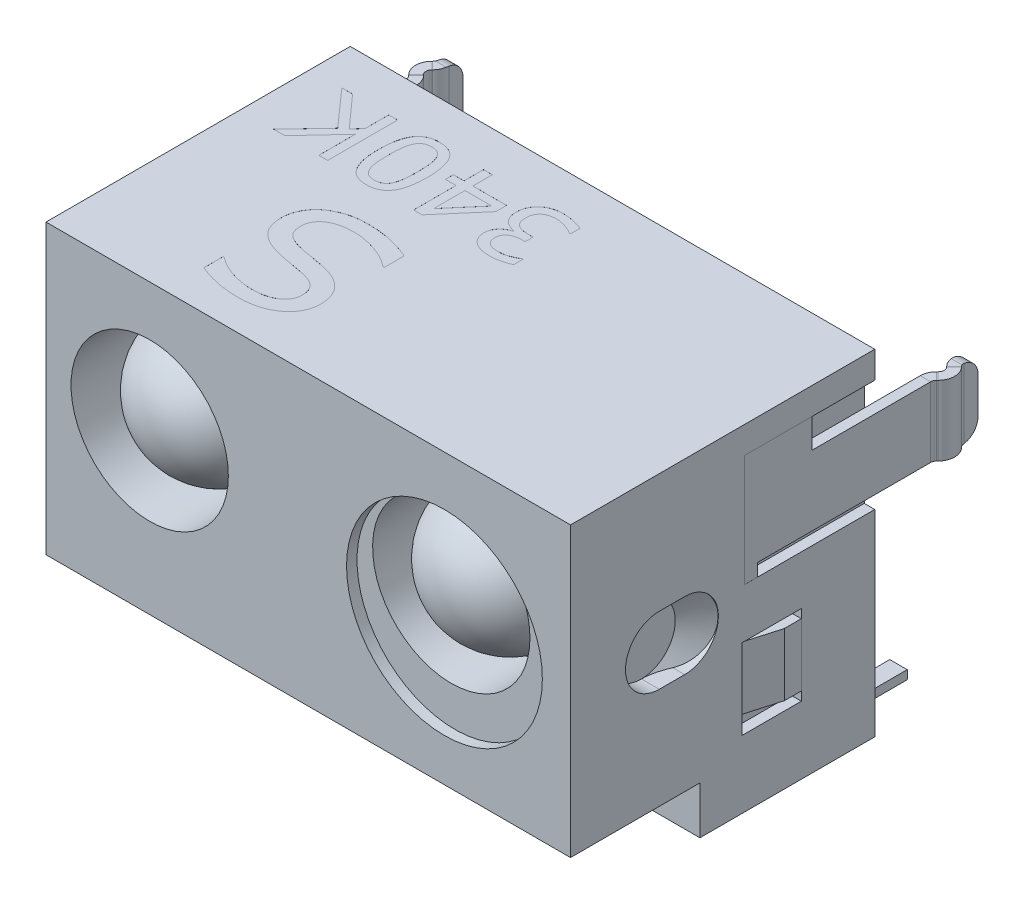
from build123d import *

# Parameters (mm, degrees)
SKETCH_1_W              = 15
SKETCH_1_H              = 9.6
EXTRUDE_1_DEPTH         = 4.3
SKETCH_2_W              = 15
SKETCH_2_H              = 8.24
EXTRUDE_2_DEPTH         = 3.7
SKETCH_3_R              = 2.25
CUT_EXTRUDE_1_DEPTH     = 2
SKETCH_4_R              = 2.8
CUT_EXTRUDE_2_DEPTH     = 0.3
SKETCH_5_R              = 2
EXTRUDE_3_DEPTH         = 0.01
SKETCH_6_W              = 1.692
SKETCH_6_H              = 2.296
CUT_EXTRUDE_3_DEPTH     = 0.3
SKETCH_7_W              = 3.021
SKETCH_7_H              = 3.2
CUT_EXTRUDE_4_DEPTH     = 0.3
SKETCH_10_W             = 3.021
SKETCH_10_H             = 3.2
CUT_EXTRUDE_5_DEPTH     = 0.3
SKETCH_11_W             = 3.021
SKETCH_11_H             = 0.3
CUT_EXTRUDE_6_DEPTH     = 20.297929941
SKETCH_14_W             = 12.76
SKETCH_14_H             = 1.791
CUT_EXTRUDE_8_DEPTH     = 0.01
SKETCH_15_W             = 0.5
SKETCH_15_H             = 0.25
EXTRUDE_4_DEPTH         = 1.31
SM_BASE_FLANGE_3_DEPTH  = 0.299
SM_EDGE_FLANGE_5_DEPTH  = 2
SM_EDGE_FLANGE_7_DEPTH  = 2
SM_EDGE_FLANGE_8_DEPTH  = 2
FILLET_1_R              = 0.473
FILLET_2_R              = 0.473
SM_BASE_FLANGE_4_DEPTH  = 0.299
SM_EDGE_FLANGE_9_DEPTH  = 2
SM_EDGE_FLANGE_10_DEPTH = 2
SM_EDGE_FLANGE_11_DEPTH = 2
FILLET_3_R              = 0.473
SKETCH_73_W             = 0.5
SKETCH_73_H             = 0.25
EXTRUDE_8_DEPTH         = 4.65
FILLET_4_R              = 0.5
FILLET_5_R              = 0.25
SKETCH_74_W             = 1.531
SKETCH_74_H             = 1.79
EXTRUDE_9_DEPTH         = 0.299
CHAMFER_1_SIZE2         = 0.299
CHAMFER_1_SIZE          = 1.047
EXTRUDE_11_DEPTH        = 0.7
SKETCH_77_W             = 1.692
SKETCH_77_H             = 2.296
CUT_EXTRUDE_11_DEPTH    = 0.3
SKETCH_78_W             = 1.531
SKETCH_78_H             = 1.79
EXTRUDE_12_DEPTH        = 0.299
CHAMFER_2_SIZE2         = 0.299
CHAMFER_2_SIZE          = 1.047
CUT_EXTRUDE_12_DEPTH    = 0.01
SKETCH_80_R             = 0.966
CUT_EXTRUDE_14_DEPTH    = 0.5
CHAMFER_START           = 14.49
CHAMFER_3_DEPTH         = 0.5
CUT_EXTRUDE_15_DEPTH    = 0.001
CUT_EXTRUDE_16_DEPTH    = 0.001


with BuildPart() as part:
    # Эскиз1 → Бобышка-Вытянуть1 (new body)
    with BuildSketch(Plane.XY):
        with Locations((7.5, -4.8)):
            Rectangle(SKETCH_1_W, SKETCH_1_H)
    extrude(amount=EXTRUDE_1_DEPTH)

    # Эскиз2 → Бобышка-Вытянуть2 (add)
    with BuildSketch(Plane.XY.offset(4.3)):
        with Locations((7.5, -4.12)):
            Rectangle(SKETCH_2_W, SKETCH_2_H)
    extrude(amount=EXTRUDE_2_DEPTH)

    # Sketch 3 → Вырез-Вытянуть1 (cut)
    with BuildSketch(Plane.XY.offset(8)):
        with Locations((2.965, -3.68)):
            Circle(SKETCH_3_R)
        with Locations((11.29, -3.68)):
            Circle(SKETCH_3_R)
    extrude(amount=-CUT_EXTRUDE_1_DEPTH, mode=Mode.SUBTRACT)

    # Sketch 4 → Вырез-Вытянуть2 (cut)
    with BuildSketch(Plane.XY.offset(8)):
        with Locations((11.394403065, -4.22)):
            Circle(SKETCH_4_R)
    extrude(amount=-CUT_EXTRUDE_2_DEPTH, mode=Mode.SUBTRACT)

    # Эскиз5 → Бобышка-Вытянуть3 (add)
    with BuildSketch(Plane.XY.offset(6)):
        with Locations(Location((2.965, -3.68, 0), (0, 0, 180))):
            Circle(SKETCH_5_R)
        with Locations(Location((11.29, -3.68, 0), (0, 0, 180))):
            Circle(SKETCH_5_R)
    extrude(amount=EXTRUDE_3_DEPTH)

    # Купол2: read off the stored shape, not the designer's step
    # Купол2 outline → Купол2 (revolve)
    with BuildSketch(Plane(origin=(2.965, -3.68, 0), x_dir=(1, 0, 0), z_dir=(0, -1, 0))):
        with BuildLine():
            Line((0, 6.01), (2, 6.009999998))
            ThreePointArc((2, 6.009999998), (1.414213563, 7.424213562), (0, 8.01))
            Line((0, 8.01), (0, 6.01))
        make_face()
    revolve(axis=Axis((2.965, -3.68, 0), (0, 0, 1)))

    # Купол3: read off the stored shape, not the designer's step
    # Купол3 outline → Купол3 (revolve)
    with BuildSketch(Plane(origin=(11.29, -3.68, 0), x_dir=(1, 0, 0), z_dir=(0, -1, 0))):
        with BuildLine():
            Line((0, 6.01), (2, 6.009999998))
            ThreePointArc((2, 6.009999998), (1.414213563, 7.424213562), (0, 8.01))
            Line((0, 8.01), (0, 6.01))
        make_face()
    revolve(axis=Axis((11.29, -3.68, 0), (0, 0, 1)))

    # Эскиз6 → Вырез-Вытянуть3 (cut)
    with BuildSketch(Plane(origin=(15, 0, 0), x_dir=(0, 0, -1), z_dir=(1, 0, 0))):
        with Locations((-2.246, -6.519)):
            Rectangle(SKETCH_6_W, SKETCH_6_H)
    extrude(amount=-CUT_EXTRUDE_3_DEPTH, mode=Mode.SUBTRACT)

    # Эскиз7 → Вырез-Вытянуть4 (cut)
    with BuildSketch(Plane(origin=(15, 0, 0), x_dir=(0, 0, -1), z_dir=(1, 0, 0))):
        with Locations((-1.5105, -2.368)):
            Rectangle(SKETCH_7_W, SKETCH_7_H)
    extrude(amount=-CUT_EXTRUDE_4_DEPTH, mode=Mode.SUBTRACT)

    # Эскиз10 → Вырез-Вытянуть5 (cut)
    with BuildSketch(Plane.ZY):
        with Locations((1.5105, -2.368)):
            Rectangle(SKETCH_10_W, SKETCH_10_H)
    extrude(amount=-CUT_EXTRUDE_5_DEPTH, mode=Mode.SUBTRACT)

    # Эскиз11 → Вырез-Вытянуть6 (cut, through all)
    with BuildSketch(Plane(origin=(14.7, 0, 0), x_dir=(0, 0, -1), z_dir=(1, 0, 0))):
        with Locations((-1.5105, -0.918)):
            Rectangle(SKETCH_11_W, SKETCH_11_H)
    extrude(amount=-CUT_EXTRUDE_6_DEPTH, mode=Mode.SUBTRACT)

    # Эскиз14 → Вырез-Вытянуть8 (cut)
    with BuildSketch(Plane.XZ.offset(9.6)):
        with Locations((7.5, 0.8955)):
            Rectangle(SKETCH_14_W, SKETCH_14_H)
    extrude(amount=-CUT_EXTRUDE_8_DEPTH, mode=Mode.SUBTRACT)

    # Эскиз15 → Бобышка-Вытянуть4 (add)
    with BuildSketch(Plane.XZ.offset(9.59)):
        with Locations((5, 0.8955)):
            Rectangle(SKETCH_15_W, SKETCH_15_H)
        with Locations((2.5, 0.8955)):
            Rectangle(SKETCH_15_W, SKETCH_15_H)
        with Locations((7.5, 0.8955)):
            Rectangle(SKETCH_15_W, SKETCH_15_H)
        with Locations((10, 0.8955)):
            Rectangle(SKETCH_15_W, SKETCH_15_H)
        with Locations((12.5, 0.8955)):
            Rectangle(SKETCH_15_W, SKETCH_15_H)
    extrude(amount=EXTRUDE_4_DEPTH)

    # Эскиз73 → Бобышка-Вытянуть8 (add)
    with BuildSketch(Plane(origin=(0, 0, 0.7705), x_dir=(-1, 0, 0), z_dir=(0, 0, -1))):
        with Locations((-2.5, -10.775)):
            Rectangle(SKETCH_73_W, SKETCH_73_H)
        with Locations((-5, -10.775)):
            Rectangle(SKETCH_73_W, SKETCH_73_H)
        with Locations((-7.5, -10.775)):
            Rectangle(SKETCH_73_W, SKETCH_73_H)
        with Locations((-10, -10.775)):
            Rectangle(SKETCH_73_W, SKETCH_73_H)
        with Locations((-12.5, -10.775)):
            Rectangle(SKETCH_73_W, SKETCH_73_H)
    extrude(amount=EXTRUDE_8_DEPTH)

    # Скругление4
    fillet_4_edges = [part.edges().sort_by_distance(p)[0] for p in [
        (2.5, -10.9, 1.0205),
        (5, -10.9, 1.0205),
        (7.5, -10.9, 1.0205),
        (10, -10.9, 1.0205),
        (12.5, -10.9, 1.0205),
    ]]
    fillet(fillet_4_edges, radius=FILLET_4_R)

    # Скругление5
    fillet_5_edges = [part.edges().sort_by_distance(p)[0] for p in [
        (2.5, -10.65, 0.7705),
        (5, -10.65, 0.7705),
        (7.5, -10.65, 0.7705),
        (10, -10.65, 0.7705),
        (12.5, -10.65, 0.7705),
    ]]
    fillet(fillet_5_edges, radius=FILLET_5_R)

    # Эскиз74 → Бобышка-Вытянуть9 (add)
    with BuildSketch(Plane(origin=(14.7, 0, 0), x_dir=(0, 0, -1), z_dir=(1, 0, 0))):
        with Locations((-2.1655, -6.519)):
            Rectangle(SKETCH_74_W, SKETCH_74_H)
    extrude(amount=EXTRUDE_9_DEPTH)

    # Фаска1
    chamfer_1_edges = [part.edges().sort_by_distance(p)[0] for p in [
        (14.999, -6.519, 2.931),
    ]]
    chamfer_1_side = [part.faces().sort_by_distance(p)[0] for p in [
        (14.999, -6.519, 2.92502),
    ]]
    chamfer(chamfer_1_edges, length=CHAMFER_1_SIZE - 0.0001, length2=CHAMFER_1_SIZE2 - 0.0001, reference=chamfer_1_side[0])  # a hair under: the kernel refuses the full size



with BuildPart() as body_2:
    # Базовая кромка3: sheet metal written as solids
    # Эскиз17 → Базовая кромка3 (new body)
    with BuildSketch(Plane(origin=(14.7, 0, 0), x_dir=(0, 0, -1), z_dir=(1, 0, 0))):
        Polygon((-1.088, -0.768), (-1.088, -1.6055), (2.3, -1.6055), (2.3, -3.6055), (-2.6585, -3.6055), (-2.6585, -3.968), (-3.021, -3.968), (-3.021, -0.768), align=None)
    extrude(amount=SM_BASE_FLANGE_3_DEPTH)

    # Ребро-кромка5: sheet metal written as solids
    # Ребро-кромка5 section (on a plane across the edge) → Ребро-кромка5 (add)
    with BuildSketch(Plane(origin=(14.999, -3.6055, -2.371658946), x_dir=(0.7071067811865512, 0, 0.7071067811865438), z_dir=(0, 1, 0))):
        with BuildLine():
            Line((-0.299, 0.071658946), (-0.299, 0.1))
            Line((-0.299, 0.1), (0, 0.1))
            Line((0, 0.1), (0, 0.071658946))
            ThreePointArc((0, 0.071658946), (0.013168841, 0.005454712), (0.050670527, -0.050670527))
            Line((0.050670527, -0.050670527), (-0.160754401, -0.262095454))
            ThreePointArc((-0.160754401, -0.262095454), (-0.263071139, -0.108967634), (-0.299, 0.071658946))
        make_face()
    extrude(amount=SM_EDGE_FLANGE_5_DEPTH)

    # Ребро-кромка7: sheet metal written as solids
    # Ребро-кромка7 section (on a plane across the edge) → Ребро-кромка7 (add)
    with BuildSketch(Plane(origin=(14.980615224, -1.6055, -2.776124025), x_dir=(-0.7071067811865478, 0, 0.7071067811865472), z_dir=(0, -1, 0))):
        with BuildLine():
            Line((-0.299, 0.173), (-0.299, 0.18))
            Line((-0.299, 0.18), (0, 0.18))
            Line((0, 0.18), (0, 0.173))
            ThreePointArc((0, 0.173), (0.050670527, 0.050670527), (0.173, 0))
            Line((0.173, 0), (0.173, -0.299))
            ThreePointArc((0.173, -0.299), (-0.160754401, -0.160754401), (-0.299, 0.173))
        make_face()
    extrude(amount=SM_EDGE_FLANGE_7_DEPTH)

    # Ребро-кромка8: sheet metal written as solids
    # Ребро-кромка8 section (on a plane across the edge) → Ребро-кромка8 (add)
    with BuildSketch(Plane(origin=(15.014090404, -3.6055, -3.1654987), x_dir=(1, 0, 0), z_dir=(0, 1, 0))):
        with BuildLine():
            Line((-0.299, 0.071658946), (-0.299, 0.473))
            Line((-0.299, 0.473), (0, 0.473))
            Line((0, 0.473), (0, 0.071658946))
            ThreePointArc((0, 0.071658946), (0.013168841, 0.005454712), (0.050670527, -0.050670527))
            Line((0.050670527, -0.050670527), (-0.160754401, -0.262095454))
            ThreePointArc((-0.160754401, -0.262095454), (-0.263071139, -0.108967634), (-0.299, 0.071658946))
        make_face()
    extrude(amount=SM_EDGE_FLANGE_8_DEPTH)

    # Скругление1
    fillet_1_edges = [body_2.edges().sort_by_distance(p)[0] for p in [
        (14.864590404, -3.6055, -3.6384987),
    ]]
    fillet(fillet_1_edges, radius=FILLET_1_R)

    # Скругление2
    fillet_2_edges = [body_2.edges().sort_by_distance(p)[0] for p in [
        (14.864590404, -1.6055, -3.6384987),
    ]]
    fillet(fillet_2_edges, radius=FILLET_2_R)


with BuildPart() as body_3:
    # Базовая кромка4: sheet metal written as solids
    # Эскиз61 → Базовая кромка4 (new body)
    with BuildSketch(Plane.ZY.offset(-0.3)):
        Polygon((2.661, -3.968), (2.661, -3.608), (-2.3, -3.608), (-2.3, -1.608), (1.091, -1.608), (1.091, -0.768), (3.021, -0.768), (3.021, -3.968), align=None)
    extrude(amount=SM_BASE_FLANGE_4_DEPTH)

    # Ребро-кромка9: sheet metal written as solids
    # Ребро-кромка9 section (on a plane across the edge) → Ребро-кромка9 (add)
    with BuildSketch(Plane(origin=(0.001, -1.608, -2.371658946), x_dir=(-0.7071067811865512, 0, 0.7071067811865438), z_dir=(0, -1, 0))):
        with BuildLine():
            Line((-0.299, 0.071658946), (-0.299, 0.1))
            Line((-0.299, 0.1), (0, 0.1))
            Line((0, 0.1), (0, 0.071658946))
            ThreePointArc((0, 0.071658946), (0.013168841, 0.005454712), (0.050670527, -0.050670527))
            Line((0.050670527, -0.050670527), (-0.160754401, -0.262095454))
            ThreePointArc((-0.160754401, -0.262095454), (-0.263071139, -0.108967634), (-0.299, 0.071658946))
        make_face()
    extrude(amount=SM_EDGE_FLANGE_9_DEPTH)

    # Ребро-кромка10: sheet metal written as solids
    # Ребро-кромка10 section (on a plane across the edge) → Ребро-кромка10 (add)
    with BuildSketch(Plane(origin=(0.019384776, -3.608, -2.776124025), x_dir=(0.7071067811865477, 0, 0.7071067811865475), z_dir=(0, 1, 0))):
        with BuildLine():
            Line((-0.299, 0.173), (-0.299, 0.18))
            Line((-0.299, 0.18), (0, 0.18))
            Line((0, 0.18), (0, 0.173))
            ThreePointArc((0, 0.173), (0.050670527, 0.050670527), (0.173, 0))
            Line((0.173, 0), (0.173, -0.299))
            ThreePointArc((0.173, -0.299), (-0.160754401, -0.160754401), (-0.299, 0.173))
        make_face()
    extrude(amount=SM_EDGE_FLANGE_10_DEPTH)

    # Ребро-кромка11: sheet metal written as solids
    # Ребро-кромка11 section (on a plane across the edge) → Ребро-кромка11 (add)
    with BuildSketch(Plane(origin=(-0.014090404, -1.608, -3.1654987), x_dir=(-1, 0, 0), z_dir=(0, -1, 0))):
        with BuildLine():
            Line((-0.299, 0.071658946), (-0.299, 0.473))
            Line((-0.299, 0.473), (0, 0.473))
            Line((0, 0.473), (0, 0.071658946))
            ThreePointArc((0, 0.071658946), (0.013168841, 0.005454712), (0.050670527, -0.050670527))
            Line((0.050670527, -0.050670527), (-0.160754401, -0.262095454))
            ThreePointArc((-0.160754401, -0.262095454), (-0.263071139, -0.108967634), (-0.299, 0.071658946))
        make_face()
    extrude(amount=SM_EDGE_FLANGE_11_DEPTH)

    # Скругление3
    fillet_3_edges = [body_3.edges().sort_by_distance(p)[0] for p in [
        (0.135409596, -3.608, -3.6384987),
        (0.135409596, -1.608, -3.6384987),
    ]]
    fillet(fillet_3_edges, radius=FILLET_3_R)


with BuildPart() as part_1:
    add(part.part)

    add(body_2.part)  # Бобышка-Вытянуть11 merges body 2

    add(body_3.part)  # Бобышка-Вытянуть11 merges body 3
    # Эскиз76 → Бобышка-Вытянуть11 (add)
    with BuildSketch(Plane(origin=(0, 0, 0), x_dir=(-1, 0, 0), z_dir=(0, 0, -1))):
        Polygon((-15, 0), (-15, -0.768), (-14.7, -0.768), (-14.7, -3.968), (-15, -3.968), (-15, -9.6), (0, -9.6), (0, -3.968), (-0.3, -3.968), (-0.3, -0.768), (0, -0.768), (0, 0), align=None)
    extrude(amount=EXTRUDE_11_DEPTH)

    # Эскиз77 → Вырез-Вытянуть11 (cut)
    with BuildSketch(Plane.ZY):
        with Locations((2.246, -6.519)):
            Rectangle(SKETCH_77_W, SKETCH_77_H)
    extrude(amount=-CUT_EXTRUDE_11_DEPTH, mode=Mode.SUBTRACT)

    # Эскиз78 → Бобышка-Вытянуть12 (add)
    with BuildSketch(Plane.ZY.offset(-0.3)):
        with Locations((2.1655, -6.519)):
            Rectangle(SKETCH_78_W, SKETCH_78_H)
    extrude(amount=EXTRUDE_12_DEPTH)

    # Фаска2
    chamfer_2_edges = [part_1.edges().sort_by_distance(p)[0] for p in [
        (0.001, -6.519, 2.931),
    ]]
    chamfer_2_side = [part_1.faces().sort_by_distance(p)[0] for p in [
        (0.001, -6.519, 2.92502),
    ]]
    chamfer(chamfer_2_edges, length=CHAMFER_2_SIZE - 0.0001, length2=CHAMFER_2_SIZE2 - 0.0001, reference=chamfer_2_side[0])  # a hair under: the kernel refuses the full size

    # Эскиз79 → Вырез-Вытянуть12 (cut)
    with BuildSketch(Plane(origin=(15, 0, 0), x_dir=(0, 0, -1), z_dir=(1, 0, 0))):
        with BuildLine():
            Line((-5.462, -3.408), (-4.737, -3.408))
            ThreePointArc((-4.737, -3.408), (-3.771, -4.374), (-4.737, -5.34))
            Line((-4.737, -5.34), (-5.462, -5.34))
            ThreePointArc((-5.462, -5.34), (-6.428, -4.374), (-5.462, -3.408))
        make_face()
    extrude(amount=-CUT_EXTRUDE_12_DEPTH, mode=Mode.SUBTRACT)

    # Эскиз80 → Вырез-Вытянуть14 (cut)
    with BuildSketch(Plane(origin=(14.99, 0, 0), x_dir=(0, 0, -1), z_dir=(1, 0, 0))):
        with Locations((-5.462, -4.374)):
            Circle(SKETCH_80_R)
    extrude(amount=-CUT_EXTRUDE_14_DEPTH, mode=Mode.SUBTRACT)

    # Фаска3: read off the stored shape, not the designer's step
    # Фаска3 outline → Фаска3 (cut)
    with BuildSketch(Plane.YZ.offset(CHAMFER_START)):
        with BuildLine():
            ThreePointArc((-5.34, 4.737), (-4.374, 3.771), (-3.408, 4.737))
            Line((-3.408, 4.737), (-3.408, 5.462))
            ThreePointArc((-3.408, 5.462), (-4.374, 4.496), (-5.34, 5.462))
            Line((-5.34, 5.462), (-5.34, 4.737))
        make_face()
    extrude(amount=CHAMFER_3_DEPTH, mode=Mode.SUBTRACT)

    # Chamfer 3 2 outline → Chamfer 3 2 (revolve)
    with BuildSketch(Plane(origin=(0, -4.374, 5.462), x_dir=(0, 1, 0), z_dir=(0, 0, -1))):
        Polygon((1.691, 14.99), (1.686, 14.99), (0.965997178, 14.489998041), (1.691, 14.49), align=None)
    revolve(axis=Axis((0, -4.374, 5.462), (1, 0, 0)))

    # Эскиз82 → Вырез-Вытянуть15 (cut)
    # profile 1 of 4: a face of its own
    with BuildSketch(Plane(origin=(0, 0, 0), x_dir=(-1, 0, 0), z_dir=(0, 1, 0))):
        with BuildLine():
            add(Edge.make_bspline(
                [(-6.623233444, 1.399667175), (-6.61272869, 1.389591118), (-6.591530093, 1.369257631), (-6.56346967, 1.334569579), (-6.538446512, 1.29619945), (-6.515999972, 1.254086049), (-6.497347226, 1.206635953), (-6.484640883, 1.153004201), (-6.477277251, 1.093041814), (-6.476233825, 1.051060607), (-6.475685976, 1.02901844)],
                knots=[0, 0, 0, 0, 0.847484043, 1.710223126, 2.592412854, 3.513457184, 4.486482436, 5.554204071, 6.715838676, 8, 8, 8, 8], degree=3))
            add(Edge.make_bspline(
                [(-6.475685976, 1.02901844), (-6.47631084, 1.006574098), (-6.477536469, 0.962551014), (-6.486710453, 0.897780745), (-6.502622493, 0.83605984), (-6.524347746, 0.777310245), (-6.551895511, 0.722236911), (-6.583982999, 0.670322807), (-6.621651008, 0.622249685), (-6.650363005, 0.593356411), (-6.664768254, 0.578860213)],
                knots=[0, 0, 0, 0, 1.072189339, 2.103028086, 3.117625413, 4.112331199, 5.08999265, 6.054966346, 7.024146796, 8, 8, 8, 8], degree=3))
            add(Edge.make_bspline(
                [(-6.664768254, 0.578860213), (-6.681991065, 0.563827282), (-6.716420034, 0.533775956), (-6.773950961, 0.495677187), (-6.835947528, 0.464167698), (-6.901855338, 0.438172762), (-6.971891474, 0.419232389), (-7.04507887, 0.404807326), (-7.121721954, 0.396478171), (-7.173846717, 0.395445696), (-7.20036952, 0.394920339)],
                knots=[0, 0, 0, 0, 0.94513944, 1.889365109, 2.845868606, 3.818496383, 4.815247057, 5.843513068, 6.902708155, 8, 8, 8, 8], degree=3))
            add(Edge.make_bspline(
                [(-7.20036952, 0.394920339), (-7.228078239, 0.395330407), (-7.283203462, 0.396146217), (-7.365599062, 0.4041613), (-7.447251984, 0.41618288), (-7.527042189, 0.433215729), (-7.602690688, 0.453175392), (-7.672323911, 0.474534742), (-7.735051671, 0.496321171), (-7.773762237, 0.512859314), (-7.792141672, 0.520711478)],
                knots=[0, 0, 0, 0, 1.091633847, 2.17175542, 3.259350248, 4.342654255, 5.384955613, 6.341552815, 7.212583926, 8, 8, 8, 8], degree=3))
            Line((-7.792141672, 0.520711478), (-7.792141672, 0.79998363))
            Line((-7.792141672, 0.79998363), (-7.771967621, 0.79998363))
            add(Edge.make_bspline(
                [(-7.771967621, 0.79998363), (-7.752348007, 0.787584369), (-7.712330593, 0.762294047), (-7.648003914, 0.728691518), (-7.578490775, 0.698728388), (-7.505187487, 0.672308148), (-7.43006877, 0.649870426), (-7.354947686, 0.634865168), (-7.281216384, 0.624588269), (-7.232444311, 0.623371347), (-7.208280913, 0.62276844)],
                knots=[0, 0, 0, 0, 0.930231768, 1.897359876, 2.905960645, 3.962824014, 5.020110383, 6.045473768, 7.03165901, 8, 8, 8, 8], degree=3))
            add(Edge.make_bspline(
                [(-7.208280913, 0.62276844), (-7.194021607, 0.62302237), (-7.164870005, 0.623541501), (-7.120759286, 0.629564721), (-7.075288225, 0.638244852), (-7.02947272, 0.650242567), (-6.984864777, 0.665499337), (-6.944009377, 0.685073491), (-6.907101839, 0.707267099), (-6.885933245, 0.725449435), (-6.875606862, 0.734319073)],
                knots=[0, 0, 0, 0, 0.955105117, 1.9526087, 2.978673282, 4.056885304, 5.124578998, 6.132597257, 7.089050672, 8, 8, 8, 8], degree=3))
            add(Edge.make_bspline(
                [(-6.875606862, 0.734319073), (-6.865732151, 0.744252572), (-6.846364193, 0.763735834), (-6.822000928, 0.79625924), (-6.800696655, 0.829518098), (-6.783258711, 0.864966337), (-6.770039931, 0.903904843), (-6.760735332, 0.947024201), (-6.755278695, 0.994860448), (-6.754548415, 1.028212513), (-6.754166988, 1.045632364)],
                knots=[0, 0, 0, 0, 0.974089691, 1.910549984, 2.822386268, 3.721564009, 4.653513387, 5.678162238, 6.787299389, 8, 8, 8, 8], degree=3))
            add(Edge.make_bspline(
                [(-6.754166988, 1.045632364), (-6.754437958, 1.062801415), (-6.754959301, 1.09583458), (-6.761905316, 1.142861414), (-6.772297517, 1.185479589), (-6.787601508, 1.223345481), (-6.806159084, 1.257360801), (-6.828521452, 1.287190629), (-6.853995594, 1.313409328), (-6.873413849, 1.327665757), (-6.883122685, 1.334793757)],
                knots=[0, 0, 0, 0, 1.246176778, 2.397637793, 3.445421562, 4.425515979, 5.35590216, 6.252488577, 7.126270542, 8, 8, 8, 8], degree=3))
            add(Edge.make_bspline(
                [(-6.883122685, 1.334793757), (-6.893650969, 1.341528336), (-6.914929578, 1.355139524), (-6.95042654, 1.370874151), (-6.988870019, 1.383518848), (-7.045283997, 1.396015278), (-7.121219901, 1.405277166), (-7.183332622, 1.406794944), (-7.215401166, 1.407578567)],
                knots=[0, 0, 0, 0, 0.651204319, 1.316142418, 2.018760635, 2.759665618, 4.327028642, 6, 6, 6, 6], degree=3))
            Line((-7.215401166, 1.407578567), (-7.336445469, 1.407578567))
            Line((-7.336445469, 1.407578567), (-7.336445469, 1.635426668))
            Line((-7.336445469, 1.635426668), (-7.244277748, 1.635426668))
            add(Edge.make_bspline(
                [(-7.244277748, 1.635426668), (-7.227914227, 1.635561313), (-7.196047382, 1.635823526), (-7.149717688, 1.640543168), (-7.105742836, 1.64693573), (-7.064433051, 1.656978591), (-7.025453194, 1.669084195), (-6.98905773, 1.684122014), (-6.955513788, 1.702537975), (-6.924079369, 1.722872664), (-6.895977366, 1.746150651), (-6.871467742, 1.772159232), (-6.850891791, 1.800837773), (-6.833591827, 1.831918243), (-6.820575471, 1.865765906), (-6.81161424, 1.90206076), (-6.805919569, 1.940759791), (-6.805180575, 1.967420745), (-6.8047999, 1.981154516)],
                knots=[0, 0, 0, 0, 1.240419804, 2.415633327, 3.528743283, 4.608144501, 5.636053556, 6.622252983, 7.58878585, 8.534609379, 9.457798559, 10.349242878, 11.237427791, 12.12814259, 13.039995841, 13.978654942, 14.958750962, 16, 16, 16, 16], degree=3))
            add(Edge.make_bspline(
                [(-6.8047999, 1.981154516), (-6.805195609, 1.993304072), (-6.8059613, 2.016813235), (-6.811439394, 2.05106508), (-6.821459094, 2.082771683), (-6.834985956, 2.112218969), (-6.851713105, 2.139333244), (-6.871542657, 2.164019733), (-6.894691478, 2.185957388), (-6.91197922, 2.198382318), (-6.920701799, 2.204651352)],
                knots=[0, 0, 0, 0, 1.109336041, 2.146544552, 3.155699887, 4.136221373, 5.098536494, 6.057531715, 7.019922155, 8, 8, 8, 8], degree=3))
            add(Edge.make_bspline(
                [(-6.920701799, 2.204651352), (-6.930226085, 2.210376443), (-6.949212687, 2.221789375), (-6.979487381, 2.23555541), (-7.010727537, 2.24666383), (-7.054900155, 2.257956434), (-7.115009017, 2.266400339), (-7.164475039, 2.267670377), (-7.19048028, 2.268338061)],
                knots=[0, 0, 0, 0, 0.711216309, 1.417805135, 2.125604048, 2.832243336, 4.334649322, 6, 6, 6, 6], degree=3))
            add(Edge.make_bspline(
                [(-7.19048028, 2.268338061), (-7.21186721, 2.267801465), (-7.255601687, 2.266704171), (-7.322038552, 2.257605301), (-7.390406604, 2.242634949), (-7.460204983, 2.222861731), (-7.529779243, 2.196931486), (-7.598374716, 2.167169575), (-7.664697766, 2.131840753), (-7.706877069, 2.104735201), (-7.728059394, 2.091122871)],
                knots=[0, 0, 0, 0, 0.894418222, 1.829010174, 2.799457441, 3.820802859, 4.860878205, 5.903159842, 6.946972907, 8, 8, 8, 8], degree=3))
            Line((-7.728059394, 2.091122871), (-7.741508761, 2.091122871))
            Line((-7.741508761, 2.091122871), (-7.741508761, 2.370395023))
            add(Edge.make_bspline(
                [(-7.741508761, 2.370395023), (-7.724459834, 2.378260304), (-7.688234837, 2.394972195), (-7.62857599, 2.416884075), (-7.560974149, 2.437489022), (-7.487178599, 2.457373842), (-7.409968849, 2.474843385), (-7.332235933, 2.486781413), (-7.255790161, 2.494914416), (-7.2052687, 2.49576435), (-7.180195469, 2.496186162)],
                knots=[0, 0, 0, 0, 0.777624147, 1.652270079, 2.630230247, 3.704883216, 4.818215269, 5.907609184, 6.961570091, 8, 8, 8, 8], degree=3))
            add(Edge.make_bspline(
                [(-7.180195469, 2.496186162), (-7.156583869, 2.49592801), (-7.110750961, 2.495426906), (-7.044164062, 2.490264952), (-6.981964061, 2.481560516), (-6.923577715, 2.469840677), (-6.868776727, 2.454013584), (-6.816897645, 2.434061665), (-6.76773497, 2.410219272), (-6.737247788, 2.390738203), (-6.722125849, 2.381075402)],
                knots=[0, 0, 0, 0, 1.181529625, 2.293488736, 3.339666156, 4.323260697, 5.271417361, 6.190562388, 7.102501307, 8, 8, 8, 8], degree=3))
            add(Edge.make_bspline(
                [(-6.722125849, 2.381075402), (-6.70664172, 2.369996119), (-6.67634985, 2.348321526), (-6.636996107, 2.309607422), (-6.602963618, 2.26800363), (-6.575187589, 2.222559506), (-6.553044145, 2.173596208), (-6.537231184, 2.120826081), (-6.528127553, 2.064011927), (-6.526933019, 2.024963966), (-6.526318887, 2.004888694)],
                knots=[0, 0, 0, 0, 1.030246025, 2.015488056, 2.980657051, 3.93641939, 4.892528807, 5.884791777, 6.912532717, 8, 8, 8, 8], degree=3))
            add(Edge.make_bspline(
                [(-6.526318887, 2.004888694), (-6.526760941, 1.99089941), (-6.527631332, 1.963354922), (-6.532680563, 1.92262783), (-6.541980715, 1.883525852), (-6.554228652, 1.845417856), (-6.570372015, 1.808813745), (-6.590455374, 1.773701973), (-6.613902224, 1.739962912), (-6.640588704, 1.70789035), (-6.66974836, 1.677927352), (-6.700627528, 1.650817566), (-6.73229441, 1.625931096), (-6.765649013, 1.604433119), (-6.800618905, 1.586547821), (-6.836298963, 1.570319597), (-6.873533513, 1.557608502), (-6.899150456, 1.551740276), (-6.911999267, 1.548796921)],
                knots=[0, 0, 0, 0, 1.040593361, 2.04889782, 3.04554796, 4.02546284, 5.02211298, 6.014605761, 7.029232238, 8.073837562, 9.114015009, 10.135206882, 11.127699663, 12.1069274, 13.080640536, 14.04642105, 15.020134186, 16, 16, 16, 16], degree=3))
            Line((-6.911999267, 1.548796921), (-6.911999267, 1.52980958))
            add(Edge.make_bspline(
                [(-6.911999267, 1.52980958), (-6.90088655, 1.52772925), (-6.877537094, 1.523358169), (-6.841827032, 1.513195345), (-6.803633857, 1.500521108), (-6.764145397, 1.484962794), (-6.724746595, 1.467220366), (-6.687632019, 1.447166019), (-6.653508566, 1.42507489), (-6.633226409, 1.408053546), (-6.623233444, 1.399667175)],
                knots=[0, 0, 0, 0, 0.847072829, 1.779824847, 2.779997163, 3.862895895, 4.959821874, 6.016836294, 7.022900478, 8, 8, 8, 8], degree=3))
        make_face()
    # profile 2 of 4: a face of its own
    with BuildSketch(Plane(origin=(0, 0, 0), x_dir=(-1, 0, 0), z_dir=(0, 1, 0))):
        Polygon((-4.652901166, 1.002515276), (-4.956698634, 1.002515276), (-4.956698634, 0.445553251), (-5.209863191, 0.445553251), (-5.209863191, 1.002515276), (-6.171888507, 1.002515276), (-6.171888507, 1.312641858), (-5.199182811, 2.445553251), (-4.956698634, 2.445553251), (-4.956698634, 1.230363377), (-4.652901166, 1.230363377), align=None)
        Polygon((-5.209863191, 1.230363377), (-5.209863191, 2.122372871), (-5.975685976, 1.230363377), align=None, mode=Mode.SUBTRACT)
    # profile 3 of 4: a face of its own
    with BuildSketch(Plane(origin=(0, 0, 0), x_dir=(-1, 0, 0), z_dir=(0, 1, 0))):
        with BuildLine():
            add(Edge.make_bspline(
                [(-2.956698634, 1.446739959), (-2.957216902, 1.402950324), (-2.958218437, 1.318328467), (-2.966246345, 1.195826865), (-2.978867853, 1.082329484), (-2.997291352, 0.977747072), (-3.021412426, 0.882354673), (-3.049889904, 0.795550418), (-3.084259751, 0.717892949), (-3.124261737, 0.649101246), (-3.170349187, 0.589115978), (-3.22146667, 0.53662536), (-3.279138014, 0.492696621), (-3.342734586, 0.456951879), (-3.412013941, 0.428558567), (-3.487347961, 0.409154518), (-3.568248185, 0.396984425), (-3.624110744, 0.395622333), (-3.652901166, 0.394920339)],
                knots=[0, 0, 0, 0, 1.462515791, 2.826257887, 4.098588437, 5.27524076, 6.370122553, 7.382635979, 8.323051561, 9.201518962, 10.033957328, 10.843681618, 11.641751814, 12.446417794, 13.274089048, 14.135116487, 15.038877147, 16, 16, 16, 16], degree=3))
            add(Edge.make_bspline(
                [(-3.652901166, 0.394920339), (-3.682090455, 0.395588667), (-3.738766087, 0.396886332), (-3.820716642, 0.409520168), (-3.896673013, 0.429287541), (-3.966388953, 0.45780505), (-4.030329892, 0.493733604), (-4.087710233, 0.538714497), (-4.139326799, 0.591317357), (-4.184172411, 0.652738344), (-4.223299113, 0.72219), (-4.257511972, 0.799907125), (-4.285562017, 0.886432797), (-4.308698765, 0.981417607), (-4.327304834, 1.084824415), (-4.340077322, 1.196996), (-4.347433378, 1.317816683), (-4.348534461, 1.401238988), (-4.349103697, 1.444366542)],
                knots=[0, 0, 0, 0, 0.975561823, 1.894207913, 2.765987644, 3.594712337, 4.406414096, 5.210884434, 6.024787292, 6.863552976, 7.746360406, 8.68618482, 9.698595331, 10.784175386, 11.95364431, 13.210072149, 14.557666754, 16, 16, 16, 16], degree=3))
            add(Edge.make_bspline(
                [(-4.349103697, 1.444366542), (-4.348581796, 1.487760602), (-4.34757197, 1.571723646), (-4.339580973, 1.693173108), (-4.326908247, 1.805880273), (-4.308385575, 1.909736956), (-4.28484291, 2.004976396), (-4.256219461, 2.091698681), (-4.221912739, 2.169556307), (-4.182209217, 2.238830862), (-4.136795242, 2.299683964), (-4.085371996, 2.352602383), (-4.02752997, 2.3970477), (-3.964084564, 2.433894724), (-3.894554225, 2.462127018), (-3.819091049, 2.481493557), (-3.737984299, 2.494249442), (-3.681829003, 2.495527687), (-3.652901166, 2.496186162)],
                knots=[0, 0, 0, 0, 1.450126419, 2.805845482, 4.065763501, 5.238744047, 6.328896909, 7.341983365, 8.2869572, 9.167511018, 10.004780552, 10.818108853, 11.62549425, 12.434993413, 13.263133086, 14.124647823, 15.033931127, 16, 16, 16, 16], degree=3))
            add(Edge.make_bspline(
                [(-3.652901166, 2.496186162), (-3.623715825, 2.495504488), (-3.56704786, 2.494180911), (-3.485009253, 2.481724475), (-3.409044019, 2.461257144), (-3.339020154, 2.432815362), (-3.275529381, 2.395553557), (-3.217925449, 2.350442825), (-3.166468075, 2.296962559), (-3.1217453, 2.234851159), (-3.082376361, 2.164877065), (-3.048527472, 2.086746035), (-3.020265457, 2.000165941), (-2.996565119, 1.905687908), (-2.97866146, 1.802671399), (-2.965692922, 1.691483355), (-2.958386462, 1.571837947), (-2.957273387, 1.489339369), (-2.956698634, 1.446739959)],
                knots=[0, 0, 0, 0, 0.976576377, 1.896177831, 2.770013405, 3.605358433, 4.418491692, 5.226516336, 6.047603033, 6.894359061, 7.781924088, 8.73081062, 9.740083278, 10.827858728, 11.989075843, 13.238041405, 14.5738202, 16, 16, 16, 16], degree=3))
        make_face()
        with BuildLine():
            add(Edge.make_bspline(
                [(-3.31548028, 0.834398187), (-3.308061962, 0.85341316), (-3.292859423, 0.89238101), (-3.275181759, 0.954586251), (-3.261567462, 1.021403858), (-3.251386294, 1.093424774), (-3.243986639, 1.171442678), (-3.239074632, 1.256551137), (-3.235872849, 1.34914183), (-3.235416609, 1.413377372), (-3.235179647, 1.446739959)],
                knots=[0, 0, 0, 0, 0.787920239, 1.614704221, 2.493559176, 3.419679904, 4.422442709, 5.519279532, 6.711566037, 8, 8, 8, 8], degree=3))
            add(Edge.make_bspline(
                [(-3.235179647, 1.446739959), (-3.235418944, 1.479838884), (-3.235881447, 1.543810798), (-3.239082615, 1.636268214), (-3.244021606, 1.722036362), (-3.251465921, 1.801220551), (-3.261251996, 1.874405749), (-3.275688317, 1.941339901), (-3.292837492, 2.002953294), (-3.308889825, 2.040763257), (-3.316666988, 2.059081732)],
                knots=[0, 0, 0, 0, 1.277209098, 2.468524563, 3.569546968, 4.59175249, 5.537266852, 6.41645201, 7.232789931, 8, 8, 8, 8], degree=3))
            add(Edge.make_bspline(
                [(-3.316666988, 2.059081732), (-3.32486084, 2.075504476), (-3.34079909, 2.107449136), (-3.370365779, 2.150777455), (-3.405509241, 2.186611295), (-3.444105319, 2.217027022), (-3.488330138, 2.24032626), (-3.537989044, 2.256883431), (-3.593566885, 2.266822212), (-3.632552251, 2.267818195), (-3.652901166, 2.268338061)],
                knots=[0, 0, 0, 0, 1.041868962, 2.026588758, 2.964039316, 3.882297917, 4.806977878, 5.787445238, 6.845128519, 8, 8, 8, 8], degree=3))
            add(Edge.make_bspline(
                [(-3.652901166, 2.268338061), (-3.6729882, 2.267818109), (-3.71158337, 2.266819077), (-3.76686039, 2.256774202), (-3.816779304, 2.240267616), (-3.861585311, 2.216974506), (-3.901369992, 2.186922169), (-3.935941264, 2.149559103), (-3.967359803, 2.106439419), (-3.983301281, 2.073610371), (-3.991508761, 2.056708314)],
                knots=[0, 0, 0, 0, 1.130982529, 2.173066616, 3.152892545, 4.083472911, 5.006338149, 5.947185184, 6.943106974, 8, 8, 8, 8], degree=3))
            add(Edge.make_bspline(
                [(-3.991508761, 2.056708314), (-3.998859035, 2.038903827), (-4.014323093, 2.001445409), (-4.031176234, 1.939530211), (-4.044862666, 1.870388488), (-4.054830405, 1.794379384), (-4.061542377, 1.712770953), (-4.066678185, 1.626775896), (-4.069889033, 1.536821999), (-4.070374689, 1.475619192), (-4.070622685, 1.444366542)],
                knots=[0, 0, 0, 0, 0.743461611, 1.564150376, 2.473168407, 3.465097376, 4.523434166, 5.635793492, 6.792739709, 8, 8, 8, 8], degree=3))
            add(Edge.make_bspline(
                [(-4.070622685, 1.444366542), (-4.07051022, 1.41074152), (-4.07029495, 1.346379541), (-4.0676004, 1.254044061), (-4.062765235, 1.170303668), (-4.056893643, 1.094212178), (-4.047401219, 1.024283942), (-4.034000403, 0.958823032), (-4.016593155, 0.896862252), (-4.000826318, 0.857876188), (-3.993091039, 0.838749453)],
                knots=[0, 0, 0, 0, 1.312806302, 2.512855192, 3.605999759, 4.587601144, 5.491851682, 6.359134938, 7.194984378, 8, 8, 8, 8], degree=3))
            add(Edge.make_bspline(
                [(-3.993091039, 0.838749453), (-3.985359539, 0.822029026), (-3.970358911, 0.789588112), (-3.940981131, 0.745912499), (-3.907199573, 0.708265604), (-3.868297752, 0.676736003), (-3.823435597, 0.652251075), (-3.772383195, 0.634832473), (-3.714747222, 0.624665717), (-3.674172707, 0.623420996), (-3.652901166, 0.62276844)],
                knots=[0, 0, 0, 0, 1.023553745, 1.985895355, 2.915557442, 3.828632731, 4.757744765, 5.743701395, 6.817115868, 8, 8, 8, 8], degree=3))
            add(Edge.make_bspline(
                [(-3.652901166, 0.62276844), (-3.632817021, 0.623301257), (-3.594097551, 0.624328455), (-3.538656142, 0.634253647), (-3.488554136, 0.650949917), (-3.443483915, 0.674000417), (-3.403680089, 0.704224215), (-3.369048891, 0.741332822), (-3.338426002, 0.784665948), (-3.323276294, 0.817501214), (-3.31548028, 0.834398187)],
                knots=[0, 0, 0, 0, 1.131665358, 2.181695236, 3.162112733, 4.099850787, 5.023273204, 5.964688273, 6.952632, 8, 8, 8, 8], degree=3))
        make_face(mode=Mode.SUBTRACT)
    # profile 4 of 4: a face of its own
    with BuildSketch(Plane(origin=(0, 0, 0), x_dir=(-1, 0, 0), z_dir=(0, 1, 0))):
        Polygon((-0.906065723, 0.445553251), (-1.213027748, 0.445553251), (-2.027901166, 1.356945656), (-2.247837875, 1.123955149), (-2.247837875, 0.445553251), (-2.501002432, 0.445553251), (-2.501002432, 2.445553251), (-2.247837875, 2.445553251), (-2.247837875, 1.402436162), (-1.277901166, 2.445553251), (-0.956698634, 2.445553251), (-1.847125849, 1.505284263), align=None)
    extrude(amount=-CUT_EXTRUDE_15_DEPTH, mode=Mode.SUBTRACT)

    # Эскиз83 → Вырез-Вытянуть16 (cut)
    with BuildSketch(Plane(origin=(0, 0, 0), x_dir=(1, 0, 0), z_dir=(0, 1, 0))):
        with BuildLine():
            add(Edge.make_bspline(
                [(3.256941406, -4.521021588), (3.258285178, -4.486578644), (3.260989026, -4.417274841), (3.278514073, -4.313756025), (3.309020712, -4.211165436), (3.350130765, -4.110091271), (3.402360465, -4.012902892), (3.464981419, -3.922763275), (3.536527444, -3.839541595), (3.591806563, -3.791885583), (3.619678748, -3.767857031)],
                knots=[0, 0, 0, 0, 0.958021327, 1.927666855, 2.910644369, 3.929648399, 4.957667134, 5.972438248, 6.977686721, 8, 8, 8, 8], degree=3))
            add(Edge.make_bspline(
                [(3.619678748, -3.767857031), (3.652001792, -3.743219312), (3.717110427, -3.693591305), (3.8239018, -3.630217809), (3.937835352, -3.574742905), (4.060005078, -3.526947624), (4.192986471, -3.489380377), (4.338033057, -3.462791624), (4.495942033, -3.446941941), (4.605400116, -3.444929731), (4.662202482, -3.443885512)],
                knots=[0, 0, 0, 0, 0.875033506, 1.762588858, 2.669740744, 3.603118349, 4.585104465, 5.642074807, 6.776374242, 8, 8, 8, 8], degree=3))
            add(Edge.make_bspline(
                [(4.662202482, -3.443885512), (4.723840765, -3.444562091), (4.844035048, -3.445881417), (5.019607615, -3.459641766), (5.185729382, -3.480192894), (5.343566425, -3.511718611), (5.497488664, -3.550149098), (5.650604107, -3.597669922), (5.805747053, -3.651867228), (5.90777003, -3.694848694), (5.959473051, -3.716630765)],
                knots=[0, 0, 0, 0, 1.107199109, 2.159031624, 3.162281418, 4.112747552, 5.048864931, 6.011432992, 6.992237584, 8, 8, 8, 8], degree=3))
            Line((5.959473051, -3.716630765), (5.959473051, -4.285657664))
            Line((5.959473051, -4.285657664), (5.926245203, -4.285657664))
            add(Edge.make_bspline(
                [(5.926245203, -4.285657664), (5.880966299, -4.251267627), (5.789925979, -4.182121077), (5.640506032, -4.094635572), (5.481303944, -4.018910956), (5.314071988, -3.9563887), (5.144660957, -3.906304518), (4.978045569, -3.870403175), (4.816807787, -3.846462944), (4.71073944, -3.843883981), (4.658741248, -3.842619689)],
                knots=[0, 0, 0, 0, 0.998389701, 2.007418688, 3.03579107, 4.093156461, 5.141409459, 6.13714428, 7.086766861, 8, 8, 8, 8], degree=3))
            add(Edge.make_bspline(
                [(4.658741248, -3.842619689), (4.623655146, -3.843187914), (4.555474351, -3.844292113), (4.456038343, -3.851779192), (4.362674863, -3.86497721), (4.275099954, -3.882611294), (4.193582778, -3.906207034), (4.118111182, -3.935223676), (4.048497189, -3.969101826), (3.985173671, -4.008005375), (3.928469468, -4.051078801), (3.879848626, -4.098798103), (3.837378162, -4.148737659), (3.803425542, -4.203171855), (3.776731082, -4.261074981), (3.758349261, -4.322634121), (3.745775324, -4.387368784), (3.744786694, -4.431890602), (3.744283178, -4.454565891)],
                knots=[0, 0, 0, 0, 1.366642471, 2.655717346, 3.88104988, 5.037391712, 6.132484954, 7.182384549, 8.183281467, 9.143647958, 10.073065321, 10.950208906, 11.792587189, 12.62050442, 13.440972499, 14.268304077, 15.118034511, 16, 16, 16, 16], degree=3))
            add(Edge.make_bspline(
                [(3.744283178, -4.454565891), (3.744784143, -4.473495963), (3.745757151, -4.510263203), (3.750335415, -4.563766467), (3.758962222, -4.613482924), (3.772619639, -4.65888225), (3.78834316, -4.700758159), (3.807544033, -4.739179499), (3.831266327, -4.773286857), (3.868511577, -4.813988397), (3.925552263, -4.859003723), (4.006949296, -4.904830199), (4.102351501, -4.946257111), (4.172490372, -4.966072034), (4.209473051, -4.976520005)],
                knots=[0, 0, 0, 0, 0.883651823, 1.716287137, 2.504195105, 3.233474421, 3.925463614, 4.590097312, 5.232369037, 5.857529957, 7.159292294, 8.601901178, 10.208257468, 12, 12, 12, 12], degree=3))
            add(Edge.make_bspline(
                [(4.209473051, -4.976520005), (4.271143243, -4.991871247), (4.398551632, -5.023586358), (4.59968851, -5.056632302), (4.814280271, -5.089004336), (4.960670465, -5.118486113), (5.036015773, -5.133660037)],
                knots=[0, 0, 0, 0, 0.905765416, 1.871278668, 2.904372202, 4, 4, 4, 4], degree=3))
            add(Edge.make_bspline(
                [(5.036015773, -5.133660037), (5.073973182, -5.142206686), (5.148120415, -5.158901987), (5.254403926, -5.190824117), (5.353136656, -5.22681316), (5.444317668, -5.266743757), (5.52783877, -5.311990315), (5.604012811, -5.361495077), (5.672314229, -5.415820401), (5.73321127, -5.474343373), (5.786513463, -5.537623653), (5.833527363, -5.604959291), (5.872114527, -5.677466285), (5.904287884, -5.754120629), (5.929123554, -5.835549348), (5.947131603, -5.921467373), (5.957565035, -6.012093161), (5.958827266, -6.073934938), (5.959473051, -6.105574594)],
                knots=[0, 0, 0, 0, 1.266624134, 2.474264611, 3.610511577, 4.686977355, 5.712409166, 6.700235896, 7.641350332, 8.550021153, 9.445706943, 10.331505153, 11.219022558, 12.114897424, 13.034683898, 13.986653806, 14.969926401, 16, 16, 16, 16], degree=3))
            add(Edge.make_bspline(
                [(5.959473051, -6.105574594), (5.958585206, -6.141889608), (5.956837569, -6.213372221), (5.937746609, -6.317778299), (5.909204361, -6.417827258), (5.867009416, -6.512164868), (5.814088586, -6.601995686), (5.748195394, -6.685688417), (5.671517063, -6.765384008), (5.583418089, -6.838431155), (5.486477201, -6.904782136), (5.382821472, -6.963027876), (5.272303882, -7.01160375), (5.155890277, -7.051803525), (5.032908781, -7.08296334), (4.903478611, -7.104670283), (4.767985843, -7.119201948), (4.675394255, -7.120460389), (4.628282387, -7.121100702)],
                knots=[0, 0, 0, 0, 0.931872662, 1.834301733, 2.717783203, 3.59893487, 4.48136172, 5.389632069, 6.32869801, 7.317646898, 8.323907998, 9.343007678, 10.367403563, 11.420952956, 12.503552397, 13.62232235, 14.790205053, 16, 16, 16, 16], degree=3))
            add(Edge.make_bspline(
                [(4.628282387, -7.121100702), (4.567330498, -7.120488625), (4.447569179, -7.119285988), (4.272075079, -7.104365123), (4.103810316, -7.084075802), (3.944195741, -7.052138271), (3.792846284, -7.014768899), (3.650097061, -6.97328361), (3.516098959, -6.928125484), (3.431216035, -6.893108843), (3.389852798, -6.876045322)],
                knots=[0, 0, 0, 0, 1.150540872, 2.260640268, 3.323646211, 4.349028923, 5.331787263, 6.26662187, 7.155329182, 8, 8, 8, 8], degree=3))
            Line((3.389852798, -6.876045322), (3.389852798, -6.323632347))
            Line((3.389852798, -6.323632347), (3.423080646, -6.323632347))
            add(Edge.make_bspline(
                [(3.423080646, -6.323632347), (3.458938033, -6.35195316), (3.533004376, -6.4104521), (3.660050712, -6.484215992), (3.801599303, -6.552284885), (3.957129187, -6.611186383), (4.121090459, -6.661116818), (4.290021841, -6.69600465), (4.460606607, -6.71857858), (4.575139751, -6.721103442), (4.632435868, -6.722366524)],
                knots=[0, 0, 0, 0, 0.844849303, 1.745104823, 2.711760625, 3.750097951, 4.820326583, 5.880845978, 6.939876331, 8, 8, 8, 8], degree=3))
            add(Edge.make_bspline(
                [(4.632435868, -6.722366524), (4.663367262, -6.721734561), (4.723691875, -6.720502062), (4.811829306, -6.71383542), (4.895181972, -6.701587407), (4.973639208, -6.683164326), (5.047850738, -6.661382002), (5.117543365, -6.634489378), (5.182071526, -6.60176056), (5.241655179, -6.564477838), (5.295380081, -6.523157148), (5.342911039, -6.479007802), (5.382637116, -6.43141287), (5.415905279, -6.381347729), (5.440580483, -6.327677309), (5.458902841, -6.271516023), (5.470391033, -6.21241744), (5.471545397, -6.171851572), (5.472131279, -6.151262885)],
                knots=[0, 0, 0, 0, 1.312084533, 2.558920986, 3.746538286, 4.881402794, 5.974475555, 7.025006136, 8.044861371, 9.038743916, 10.001887423, 10.915836194, 11.784264032, 12.625802483, 13.457724344, 14.281023221, 15.127555335, 16, 16, 16, 16], degree=3))
            add(Edge.make_bspline(
                [(5.472131279, -6.151262885), (5.470961342, -6.116311654), (5.468720558, -6.049369448), (5.4474874, -5.954779317), (5.410682518, -5.872407905), (5.368600736, -5.812828737), (5.326445832, -5.772005652), (5.289774339, -5.743066736), (5.247547489, -5.715842907), (5.200189024, -5.690378588), (5.146887361, -5.667779907), (5.08878467, -5.646163421), (5.024862303, -5.626984707), (4.980221133, -5.615746559), (4.957099634, -5.60992586)],
                knots=[0, 0, 0, 0, 1.522838282, 2.916697085, 4.195922976, 5.435917193, 6.069245623, 6.749744109, 7.469862579, 8.257736635, 9.091507726, 9.992523728, 10.960245413, 12, 12, 12, 12], degree=3))
            add(Edge.make_bspline(
                [(4.957099634, -5.60992586), (4.928957801, -5.604110742), (4.867666116, -5.59144567), (4.767588929, -5.571887417), (4.651415344, -5.55143964), (4.523659886, -5.529697133), (4.393440407, -5.506308669), (4.269415497, -5.482316636), (4.156092022, -5.457569173), (4.084370996, -5.43978525), (4.050256279, -5.431326176)],
                knots=[0, 0, 0, 0, 0.746020183, 1.624799472, 2.647113195, 3.808238999, 4.989145913, 6.081740315, 7.087563454, 8, 8, 8, 8], degree=3))
            add(Edge.make_bspline(
                [(4.050256279, -5.431326176), (4.018298763, -5.42246512), (3.955953275, -5.405178206), (3.86639991, -5.373637514), (3.782660838, -5.33960328), (3.705591751, -5.300920614), (3.633657991, -5.260660572), (3.56876024, -5.215094434), (3.508826975, -5.167797901), (3.455421007, -5.116070467), (3.408959982, -5.059398492), (3.367404474, -4.998467213), (3.334012099, -4.931259344), (3.30491995, -4.859783807), (3.284121396, -4.782237687), (3.267841957, -4.699971776), (3.259191682, -4.612118426), (3.257705602, -4.551958159), (3.256941406, -4.521021588)],
                knots=[0, 0, 0, 0, 1.202754807, 2.346438178, 3.442407137, 4.479404788, 5.473059904, 6.42974364, 7.352725964, 8.240689308, 9.120646034, 10.007543371, 10.909793952, 11.837811349, 12.802554966, 13.817146126, 14.87749807, 16, 16, 16, 16], degree=3))
        make_face()
    extrude(amount=-CUT_EXTRUDE_16_DEPTH, mode=Mode.SUBTRACT)


solid = part_1.part
